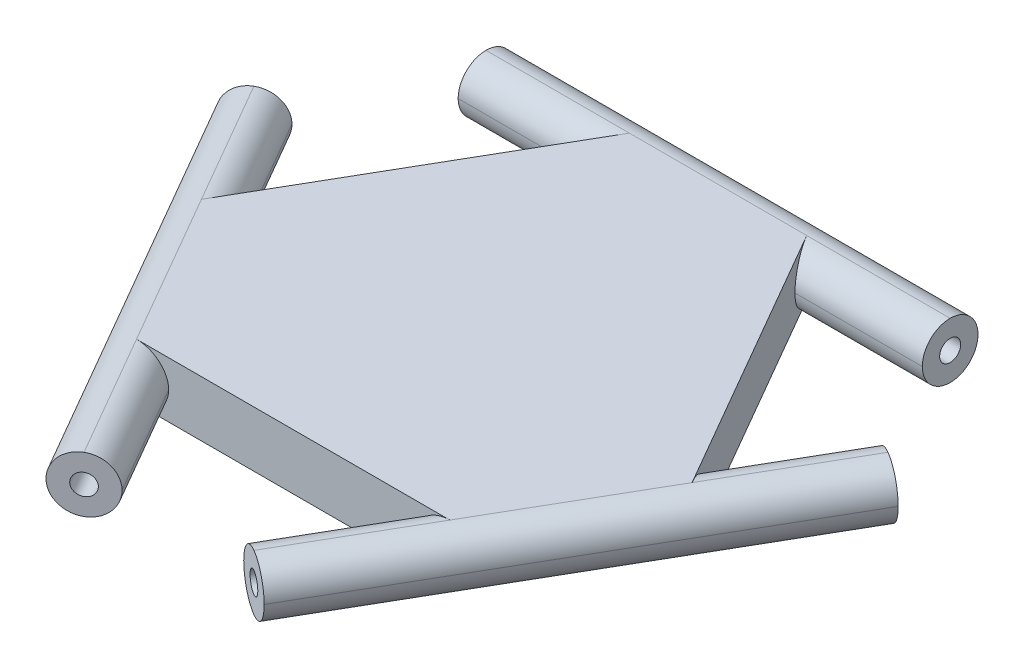
from build123d import *

# Parameters (mm, degrees)
BOSS_EXTRUDE1_DEPTH   = 6
FILLET3_R             = 3
F_4_40_TAPPED_HOLE1_D = 2.2606
F_4_40_TAPPED_HOLE2_D = 2.2606
F_4_40_TAPPED_HOLE3_D = 2.2606


with BuildPart() as part:
    # Sketch1 → Boss-Extrude1 (new body)
    with BuildSketch(Plane(origin=(0, 0, 0), x_dir=(1, 0, 0), z_dir=(0, 1, 0))):
        Polygon((-24.694969511, -1.227058116), (-11.284821255, 22), (-25, 22), (-25, 28), (25, 28), (25, 22), (11.284821255, 22), (24.694969511, -1.227058116), (31.552558883, 10.650635095), (36.748711306, 7.650635095), (11.748711306, -35.650635095), (6.552558883, -32.650635095), (13.410148256, -20.772941884), (-13.410148256, -20.772941884), (-6.552558883, -32.650635095), (-11.748711306, -35.650635095), (-36.748711306, 7.650635095), (-31.552558883, 10.650635095), align=None)
    extrude(amount=BOSS_EXTRUDE1_DEPTH)

    # Fillet3
    fillet3_edges = [part.edges().sort_by_distance(p)[0] for p in [
        (24.248711306, 0, 14),
        (24.248711306, 6, 14),
        (0, 0, -28),
        (0, 6, -28),
        (-24.248711306, 0, 14),
        (-24.248711306, 6, 14),
        (9.981353569, 0, 26.711788489),
        (9.981353569, 6, 26.711788489),
        (28.123764197, 0, -4.711788489),
        (28.123764197, 6, -4.711788489),
        (18.142410628, 0, -22),
        (18.142410628, 6, -22),
        (-18.142410628, 6, -22),
        (-18.142410628, 0, -22),
        (-28.123764197, 6, -4.711788489),
        (-28.123764197, 0, -4.711788489),
        (-9.981353569, 0, 26.711788489),
        (-9.981353569, 6, 26.711788489),
    ]]
    fillet(fillet3_edges, radius=FILLET3_R - 0.0001)  # a hair under: the kernel refuses the full size

    # #4-40 Tapped Hole1 (through all)
    with Locations(Plane(origin=(12.5, 0, 21.650635095), x_dir=(0.866025403784438, 0, -0.5000000000000012), z_dir=(0.5000000000000012, 0, 0.866025403784438))):
        with Locations((-25, 3)):
            Hole(F_4_40_TAPPED_HOLE1_D / 2)

    # #4-40 Tapped Hole2 (through all)
    with Locations(Plane(origin=(12.5, 0, -21.650635095), x_dir=(-0.8660254037844389, 0, -0.4999999999999995), z_dir=(0.4999999999999995, 0, -0.8660254037844389))):
        with Locations((-25, 3)):
            Hole(F_4_40_TAPPED_HOLE2_D / 2)

    # #4-40 Tapped Hole3 (through all)
    with Locations(Plane.ZY.offset(25)):
        with Locations((-25, 3)):
            Hole(F_4_40_TAPPED_HOLE3_D / 2)


solid = part.part
